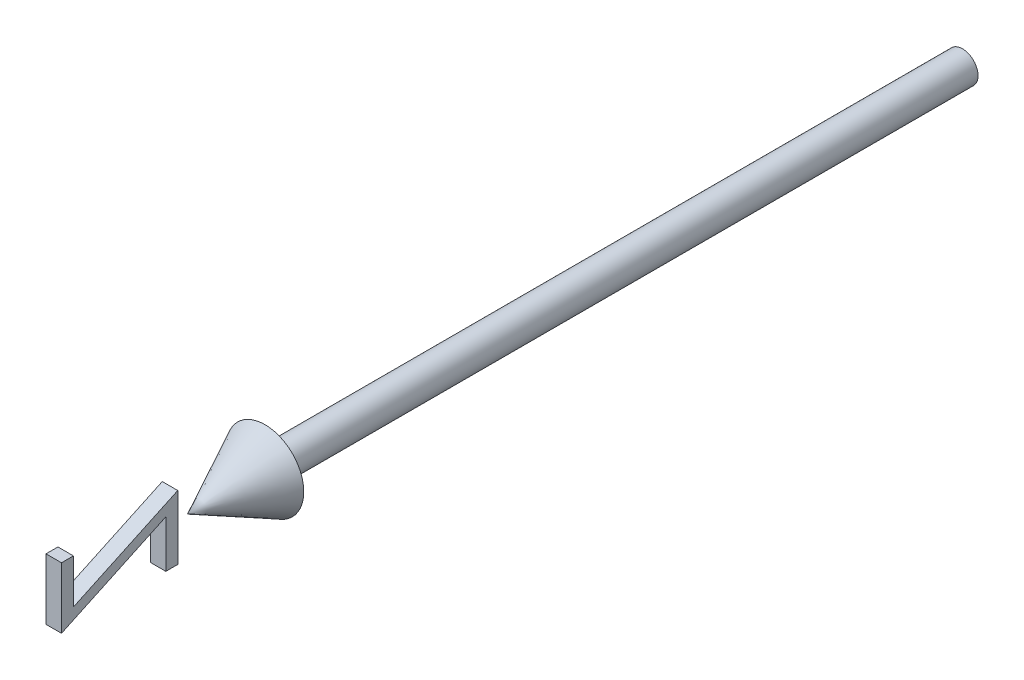
from build123d import *

# Parameters (mm, degrees)
BOSS_EXTRUDE1_DEPTH      = 1
BOSS_EXTRUDE1_DEPTH_BACK = 1


with BuildPart() as part:
    # Sketch2 → Revolve1 (revolve)
    with BuildSketch(Plane(origin=(0, 0, 0), x_dir=(1, 0, 0), z_dir=(0, 1, 0))):
        Polygon((0, -100), (5, -90), (2, -90), (2, 0), (0, 0), align=None)
    revolve(axis=Axis((0, 0, -41.949952025), (0, 0, 1)))


with BuildPart() as body_2:
    # Sketch3 → Boss-Extrude1 (new, two sides: drawn at the far end of the back side and taken through both)
    with BuildSketch(Plane(origin=(0, 0, 0), x_dir=(0, -1, 0), z_dir=(1, 0, 0)).offset(-BOSS_EXTRUDE1_DEPTH_BACK)):
        Polygon((-3.694719939, -115.722267453), (-3.694719939, -117.260728991), (4.189895446, -117.260728991), (-2.102171862, -103.79919053), (3.997587754, -103.79919053), (3.997587754, -102.260728991), (-4.271643016, -102.260728991), (2.020424292, -115.722267453), align=None)
    extrude(amount=BOSS_EXTRUDE1_DEPTH + BOSS_EXTRUDE1_DEPTH_BACK)


solid = Compound([part.part, body_2.part])
